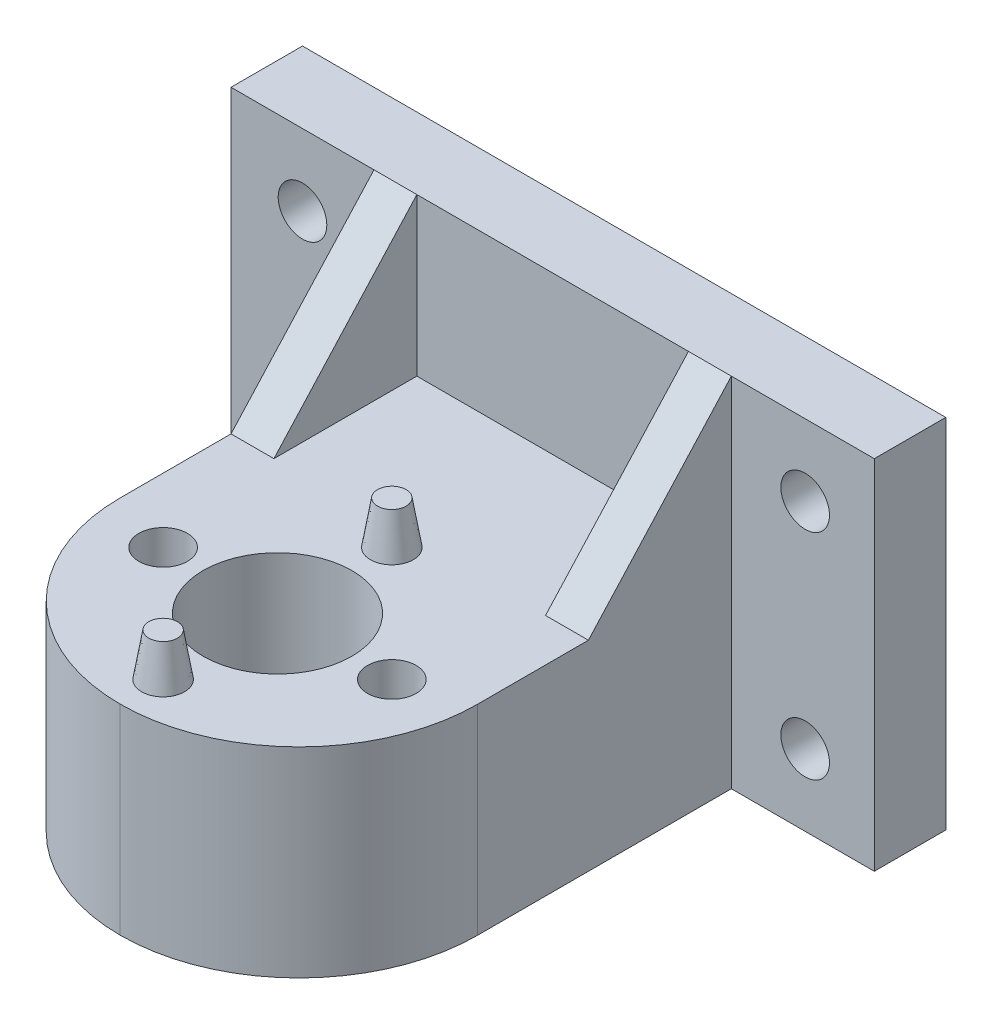
from build123d import *
from OCP.BRepFilletAPI import BRepFilletAPI_MakeChamfer

# Parameters (mm, degrees)
SKETCH1_R           = 1.7
BOSS_EXTRUDE1_DEPTH = 5
SKETCH2_R           = 1.7
BOSS_EXTRUDE2_DEPTH = 14
SKETCH3_R           = 1.5
BOSS_EXTRUDE3_DEPTH = 3
CHAMFER1_SIZE       = 3
CHAMFER1_SIZE_2     = 0.5
FILLET1_R           = 12.5
SKETCH4_W           = 3
SKETCH4_H           = 10
BOSS_EXTRUDE4_DEPTH = 11
CHAMFER2_SIZE       = 10
CHAMFER2_SIZE_2     = 11


with BuildPart() as part:
    # Sketch1 → Boss-Extrude1 (new body)
    with BuildSketch(Plane.XY):
        Polygon((-93.960167873, 235.92362241), (-129.123766163, 235.92362241), (-134.123766163, 235.92362241), (-134.123766163, 210.92362241), (-129.123766163, 210.92362241), (-93.960167873, 210.92362241), (-89.123766163, 210.92362241), (-89.123766163, 235.92362241), align=None)
        with Locations((-93.960167873, 215.92362241)):
            Circle(SKETCH1_R, mode=Mode.SUBTRACT)
        with Locations((-93.960167873, 230.92362241)):
            Circle(SKETCH1_R, mode=Mode.SUBTRACT)
        with Locations((-129.123766163, 215.92362241)):
            Circle(SKETCH1_R, mode=Mode.SUBTRACT)
        with Locations((-129.123766163, 230.92362241)):
            Circle(SKETCH1_R, mode=Mode.SUBTRACT)
    extrude(amount=BOSS_EXTRUDE1_DEPTH)

    # Sketch2 → Boss-Extrude2 (add)
    # profile 1 of 2: a face of its own
    with BuildSketch(Plane.XZ.offset(-210.92362241)):
        with BuildLine():
            Line((-111.623766166, 19.049999998), (-111.623766166, 5))
            Line((-111.623766166, 5), (-99.123766166, 5))
            Line((-99.123766166, 5), (-99.123766166, 35.249999998))
            Line((-99.123766166, 35.249999998), (-111.623766166, 35.249999998))
            Line((-111.623766166, 35.249999998), (-111.623766166, 29.449999998))
            ThreePointArc((-111.623766166, 29.449999998), (-107.946810904, 27.92695526), (-106.423766166, 24.249999998))
            ThreePointArc((-106.423766166, 24.249999998), (-107.946810904, 20.573044736), (-111.623766166, 19.049999998))
        make_face()
        with Locations(Location((-103.623766166, 24.249999998, 0), (0, 0, 270))):
            Circle(SKETCH2_R, mode=Mode.SUBTRACT)
    # profile 2 of 2: a face of its own
    with BuildSketch(Plane.XZ.offset(-210.92362241)):
        with BuildLine():
            Line((-124.123766166, 5), (-111.623766166, 5))
            Line((-111.623766166, 5), (-111.623766166, 19.049999998))
            ThreePointArc((-111.623766166, 19.049999998), (-116.823766166, 24.249999998), (-111.623766166, 29.449999998))
            Line((-111.623766166, 29.449999998), (-111.623766166, 35.249999998))
            Line((-111.623766166, 35.249999998), (-124.123766166, 35.249999998))
            Line((-124.123766166, 35.249999998), (-124.123766166, 5))
        make_face()
        with Locations(Location((-119.623766166, 24.249999998, 0), (0, 0, 270))):
            Circle(SKETCH2_R, mode=Mode.SUBTRACT)
    extrude(amount=-BOSS_EXTRUDE2_DEPTH)

    # Sketch3 → Boss-Extrude3 (add)
    with BuildSketch(Plane(origin=(0, 224.92362241, 0), x_dir=(1, 0, 0), z_dir=(0, 1, 0))):
        with Locations(Location((-111.623766166, -16.249999998, 0), (0, 0, 270))):
            Circle(SKETCH3_R)
        with Locations(Location((-111.623766166, -32.249999998, 0), (0, 0, 270))):
            Circle(SKETCH3_R)
    extrude(amount=BOSS_EXTRUDE3_DEPTH)

    # Chamfer1
    chamfer1_edges_1 = [part.edges().sort_by_distance(p)[0] for p in [
        (-111.623766166, 227.92362241, 14.749999998),
    ]]
    chamfer1_side_1 = [part.faces().sort_by_distance(p)[0] for p in [
        (-111.623766166, 227.91362241, 14.749999998),
    ]]
    chamfer1_edges_2 = [part.edges().sort_by_distance(p)[0] for p in [
        (-111.623766166, 227.92362241, 30.749999998),
    ]]
    chamfer1_side_2 = [part.faces().sort_by_distance(p)[0] for p in [
        (-111.623766166, 227.91362241, 30.749999998),
    ]]
    chamfer1 = BRepFilletAPI_MakeChamfer(part.part.solid().wrapped)
    for e in chamfer1_edges_1:
        chamfer1.Add(CHAMFER1_SIZE - 0.0001, CHAMFER1_SIZE_2 - 0.0001, e.wrapped, chamfer1_side_1[0].wrapped)
    for e in chamfer1_edges_2:
        chamfer1.Add(CHAMFER1_SIZE - 0.0001, CHAMFER1_SIZE_2 - 0.0001, e.wrapped, chamfer1_side_2[0].wrapped)
    add(Compound.cast(chamfer1.Shape()), mode=Mode.REPLACE)  # a hair under: the kernel refuses the full size

    # Fillet1
    fillet1_edges = [part.edges().sort_by_distance(p)[0] for p in [
        (-99.123766166, 217.92362241, 35.249999998),
        (-124.123766166, 217.92362241, 35.249999998),
    ]]
    fillet(fillet1_edges, radius=FILLET1_R - 0.0001)  # a hair under: the kernel refuses the full size

    # Sketch4 → Boss-Extrude4 (add)
    with BuildSketch(Plane(origin=(0, 224.92362241, 0), x_dir=(1, 0, 0), z_dir=(0, 1, 0))):
        with Locations((-122.623766166, -10)):
            Rectangle(SKETCH4_W, SKETCH4_H)
        with Locations((-100.623766166, -10)):
            Rectangle(SKETCH4_W, SKETCH4_H)
    extrude(amount=BOSS_EXTRUDE4_DEPTH)

    # Chamfer2
    chamfer2_edges_1 = [part.edges().sort_by_distance(p)[0] for p in [
        (-100.623766166, 235.92362241, 15),
    ]]
    chamfer2_side_1 = [part.faces().sort_by_distance(p)[0] for p in [
        (-100.623766166, 235.92362241, 14.8),
    ]]
    chamfer2_edges_2 = [part.edges().sort_by_distance(p)[0] for p in [
        (-122.623766166, 235.92362241, 15),
    ]]
    chamfer2_side_2 = [part.faces().sort_by_distance(p)[0] for p in [
        (-122.623766166, 235.92362241, 14.8),
    ]]
    chamfer2 = BRepFilletAPI_MakeChamfer(part.part.solid().wrapped)
    for e in chamfer2_edges_1:
        chamfer2.Add(CHAMFER2_SIZE - 0.0001, CHAMFER2_SIZE_2 - 0.0001, e.wrapped, chamfer2_side_1[0].wrapped)
    for e in chamfer2_edges_2:
        chamfer2.Add(CHAMFER2_SIZE - 0.0001, CHAMFER2_SIZE_2 - 0.0001, e.wrapped, chamfer2_side_2[0].wrapped)
    add(Compound.cast(chamfer2.Shape()), mode=Mode.REPLACE)  # a hair under: the kernel refuses the full size


solid = part.part
